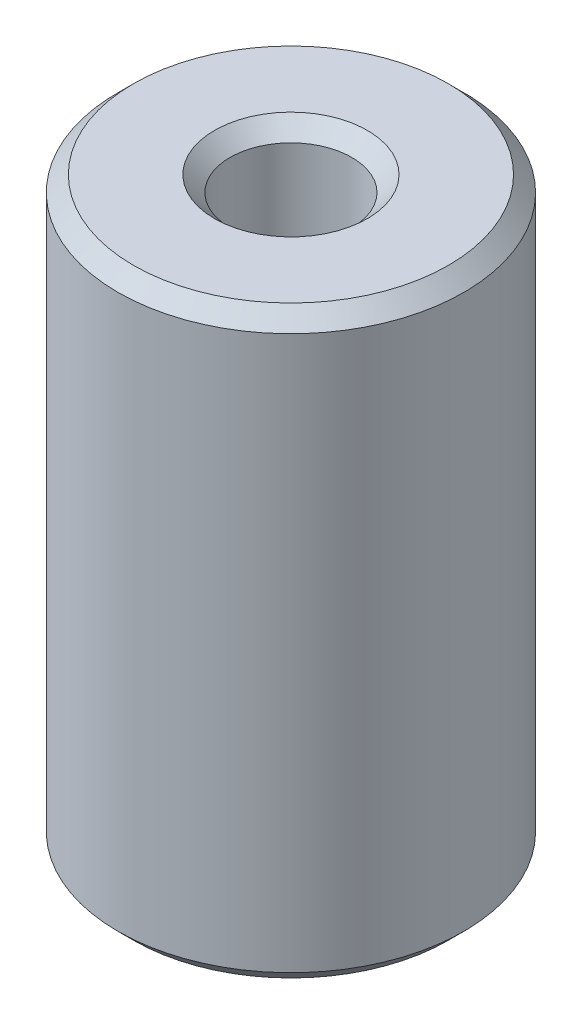
from build123d import *

# Parameters (mm, degrees)
SKETCH1_R           = 5
BOSS_EXTRUDE1_DEPTH = 16.894901955
SKETCH2_R           = 1.759290852
CUT_EXTRUDE1_DEPTH  = 19.314958696
CHAMFER1_SIZE       = 0.450390786


with BuildPart() as part:
    # Sketch1 → Boss-Extrude1 (new body)
    with BuildSketch(Plane(origin=(0, 0, 0), x_dir=(1, 0, 0), z_dir=(0, 1, 0))):
        Circle(SKETCH1_R)
    extrude(amount=BOSS_EXTRUDE1_DEPTH)

    # Sketch2 → Cut-Extrude1 (cut, through all)
    with BuildSketch(Plane(origin=(0, 0, 0), x_dir=(1, 0, 0), z_dir=(0, 1, 0))):
        Circle(SKETCH2_R)
    extrude(amount=CUT_EXTRUDE1_DEPTH, mode=Mode.SUBTRACT)

    # Chamfer1
    chamfer1_edges = [part.edges().sort_by_distance(p)[0] for p in [
        (-1.759290852, 16.894901955, 0),
        (-1.759290852, 0, 0),
        (-5, 0, 0),
        (-5, 16.894901955, 0),
    ]]
    chamfer(chamfer1_edges, length=CHAMFER1_SIZE)


solid = part.part
